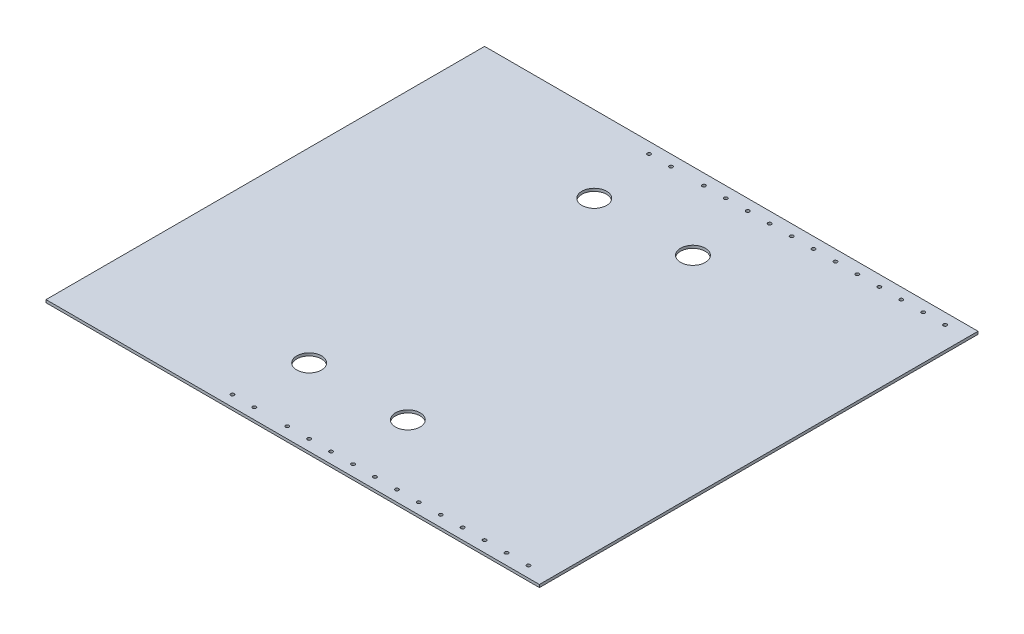
from build123d import *

# Parameters (mm, degrees)
SKETCH1_W               = 571.5
SKETCH1_H               = 508
BOSS_EXTRUDE1_DEPTH     = 3.175
SKETCH2_R               = 14.2875
CUT_EXTRUDE1_DEPTH      = 3.175
CUT_EXTRUDE3_DEPTH      = 765.64784746
CUT_EXTRUDE3_DEPTH_BACK = 765.64784746
SKETCH4_R               = 2.0193


with BuildPart() as part:
    # Sketch1 → Boss-Extrude1 (new body)
    with BuildSketch(Plane(origin=(0, 0, 0), x_dir=(1, 0, 0), z_dir=(0, 1, 0))):
        with Locations((285.75, 254)):
            Rectangle(SKETCH1_W, SKETCH1_H)
    extrude(amount=BOSS_EXTRUDE1_DEPTH)

    # Sketch2 → Cut-Extrude1 (cut)
    with BuildSketch(Plane(origin=(0, 3.175, 0), x_dir=(1, 0, 0), z_dir=(0, 1, 0))):
        with Locations((215.9, 419.1)):
            Circle(SKETCH2_R)
        with Locations((330.2, 419.1)):
            Circle(SKETCH2_R)
        with Locations((215.9, 88.9)):
            Circle(SKETCH2_R)
        with Locations((330.2, 88.9)):
            Circle(SKETCH2_R)
    extrude(amount=-CUT_EXTRUDE1_DEPTH, mode=Mode.SUBTRACT)

    # Sketch4 → Cut-Extrude3 (cut, two sides: drawn at the far end of the back side and taken through both)
    with BuildSketch(Plane(origin=(0, 3.175, 0), x_dir=(1, 0, 0), z_dir=(0, 1, 0)).offset(-CUT_EXTRUDE3_DEPTH_BACK)):
        with Locations((546.1, 495.3)):
            Circle(SKETCH4_R)
        with Locations((520.7, 495.3)):
            Circle(SKETCH4_R)
        with Locations((495.3, 495.3)):
            Circle(SKETCH4_R)
        with Locations((469.9, 495.3)):
            Circle(SKETCH4_R)
        with Locations((444.5, 495.3)):
            Circle(SKETCH4_R)
        with Locations((419.1, 495.3)):
            Circle(SKETCH4_R)
        with Locations((393.7, 495.3)):
            Circle(SKETCH4_R)
        with Locations((368.3, 495.3)):
            Circle(SKETCH4_R)
        with Locations((342.9, 495.3)):
            Circle(SKETCH4_R)
        with Locations((317.5, 495.3)):
            Circle(SKETCH4_R)
        with Locations((292.1, 495.3)):
            Circle(SKETCH4_R)
        with Locations((266.7, 495.3)):
            Circle(SKETCH4_R)
        with Locations((228.6, 495.3)):
            Circle(SKETCH4_R)
        with Locations((203.2, 495.3)):
            Circle(SKETCH4_R)
        with Locations((203.2, 12.7)):
            Circle(SKETCH4_R)
        with Locations((228.6, 12.7)):
            Circle(SKETCH4_R)
        with Locations((266.7, 12.7)):
            Circle(SKETCH4_R)
        with Locations((292.1, 12.7)):
            Circle(SKETCH4_R)
        with Locations((317.5, 12.7)):
            Circle(SKETCH4_R)
        with Locations((342.9, 12.7)):
            Circle(SKETCH4_R)
        with Locations((368.3, 12.7)):
            Circle(SKETCH4_R)
        with Locations((393.7, 12.7)):
            Circle(SKETCH4_R)
        with Locations((419.1, 12.7)):
            Circle(SKETCH4_R)
        with Locations((444.5, 12.7)):
            Circle(SKETCH4_R)
        with Locations((469.9, 12.7)):
            Circle(SKETCH4_R)
        with Locations((495.3, 12.7)):
            Circle(SKETCH4_R)
        with Locations((520.7, 12.7)):
            Circle(SKETCH4_R)
        with Locations((546.1, 12.7)):
            Circle(SKETCH4_R)
    extrude(amount=CUT_EXTRUDE3_DEPTH + CUT_EXTRUDE3_DEPTH_BACK, mode=Mode.SUBTRACT)


solid = part.part
